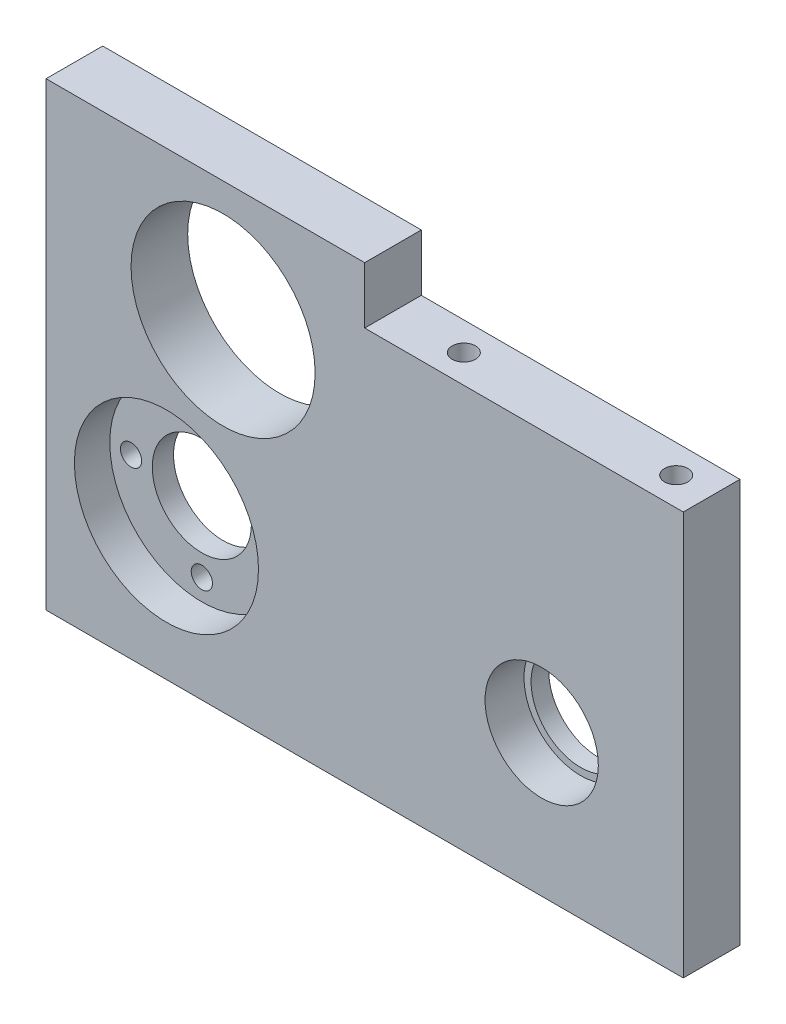
from build123d import *

# Parameters (mm, degrees)
ESQUISSE1_W             = 90
ESQUISSE1_H             = 65
ESQUISSE1_R             = 7
ESQUISSE1_R_2           = 13
BOSS_EXTRU_1_DEPTH      = 8
ESQUISSE2_R             = 13
BOSS_EXTRU_2_DEPTH      = 3
ESQUISSE3_R             = 7
ESQUISSE3_R_2           = 1.5
ENL_V_MAT_EXTRU_1_DEPTH = 112.130553854
ESQUISSE4_R             = 8
ENL_V_MAT_EXTRU_2_DEPTH = 5.5
ESQUISSE5_W             = 45
ESQUISSE5_H             = 8
ENL_V_MAT_EXTRU_3_DEPTH = 112.30588484
ESQUISSE6_R             = 1.65
ENL_V_MAT_EXTRU_4_DEPTH = 10
ESQUISSE7_R             = 1.65
ENL_V_MAT_EXTRU_5_DEPTH = 10


with BuildPart() as part:
    # Esquisse1 → Boss.-Extru.1 (new body)
    with BuildSketch(Plane.XY):
        with Locations((45, 32.5)):
            Rectangle(ESQUISSE1_W, ESQUISSE1_H)
        with Locations((70, 20)):
            Circle(ESQUISSE1_R, mode=Mode.SUBTRACT)
        with Locations((17, 20)):
            Circle(ESQUISSE1_R_2, mode=Mode.SUBTRACT)
        with Locations((25, 48)):
            Circle(ESQUISSE1_R_2, mode=Mode.SUBTRACT)
    extrude(amount=BOSS_EXTRU_1_DEPTH)

    # Esquisse2 → Boss.-Extru.2 (add)
    with BuildSketch(Plane(origin=(0, 0, 0), x_dir=(-1, 0, 0), z_dir=(0, 0, -1))):
        with Locations((-17, 20)):
            Circle(ESQUISSE2_R)
    extrude(amount=-BOSS_EXTRU_2_DEPTH)

    # Esquisse3 → Enlèv. mat.-Extru.1 (cut, through all)
    with BuildSketch(Plane.XY.offset(3)):
        with Locations((17, 20)):
            Circle(ESQUISSE3_R)
        with Locations((27, 20)):
            Circle(ESQUISSE3_R_2)
        with Locations((17, 10)):
            Circle(ESQUISSE3_R_2)
        with Locations((7, 20)):
            Circle(ESQUISSE3_R_2)
        with Locations((17, 30)):
            Circle(ESQUISSE3_R_2)
    extrude(amount=-ENL_V_MAT_EXTRU_1_DEPTH, mode=Mode.SUBTRACT)

    # Esquisse4 → Enlèv. mat.-Extru.2 (cut)
    with BuildSketch(Plane.XY.offset(8)):
        with Locations((70, 20)):
            Circle(ESQUISSE4_R)
    extrude(amount=-ENL_V_MAT_EXTRU_2_DEPTH, mode=Mode.SUBTRACT)

    # Esquisse5 → Enlèv. mat.-Extru.3 (cut, through all)
    with BuildSketch(Plane.XY.offset(8)):
        with Locations((67.5, 61)):
            Rectangle(ESQUISSE5_W, ESQUISSE5_H)
    extrude(amount=-ENL_V_MAT_EXTRU_3_DEPTH, mode=Mode.SUBTRACT)

    # Esquisse6 → Enlèv. mat.-Extru.4 (cut)
    with BuildSketch(Plane.ZY):
        with Locations((4, 7)):
            Circle(ESQUISSE6_R)
        with Locations((4, 35)):
            Circle(ESQUISSE6_R)
    extrude(amount=-ENL_V_MAT_EXTRU_4_DEPTH, mode=Mode.SUBTRACT)

    # Esquisse7 → Enlèv. mat.-Extru.5 (cut)
    with BuildSketch(Plane(origin=(0, 57, 0), x_dir=(1, 0, 0), z_dir=(0, 1, 0))):
        with Locations((85, -4)):
            Circle(ESQUISSE7_R)
        with Locations((55, -4)):
            Circle(ESQUISSE7_R)
    extrude(amount=-ENL_V_MAT_EXTRU_5_DEPTH, mode=Mode.SUBTRACT)


solid = part.part
